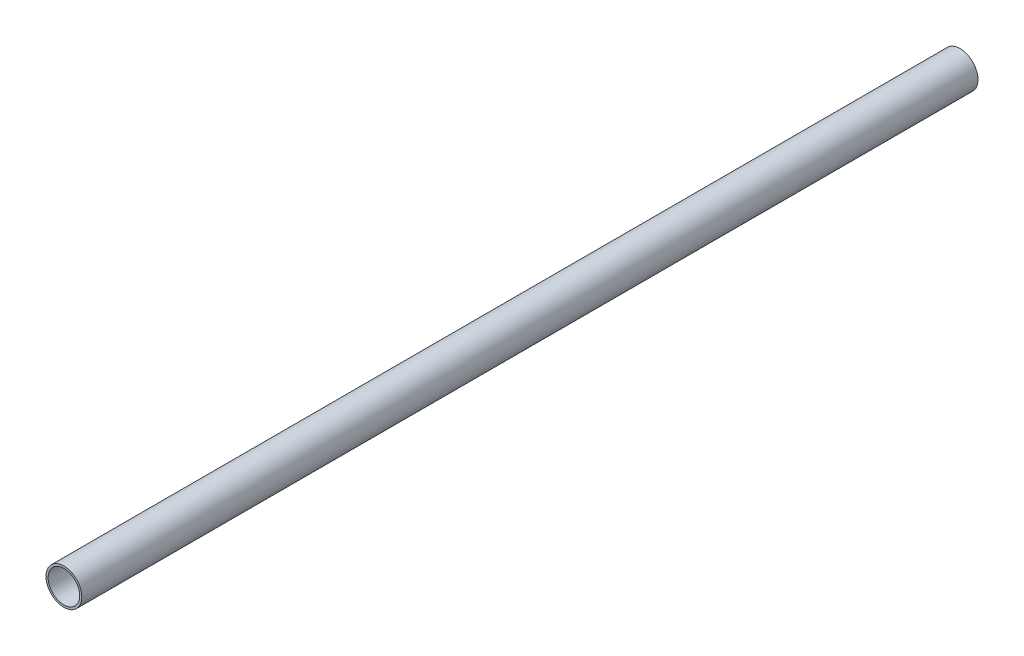
from build123d import *

# Parameters (mm, degrees)
PIPESKETCH_R    = 16
PIPESKETCH_R_2  = 14.1
EXTRUSION_DEPTH = 800


with BuildPart() as part:
    # PipeSketch → Extrusion (new body)
    with BuildSketch(Plane.XY):
        Circle(PIPESKETCH_R)
        Circle(PIPESKETCH_R_2, mode=Mode.SUBTRACT)
    extrude(amount=EXTRUSION_DEPTH)


solid = part.part
